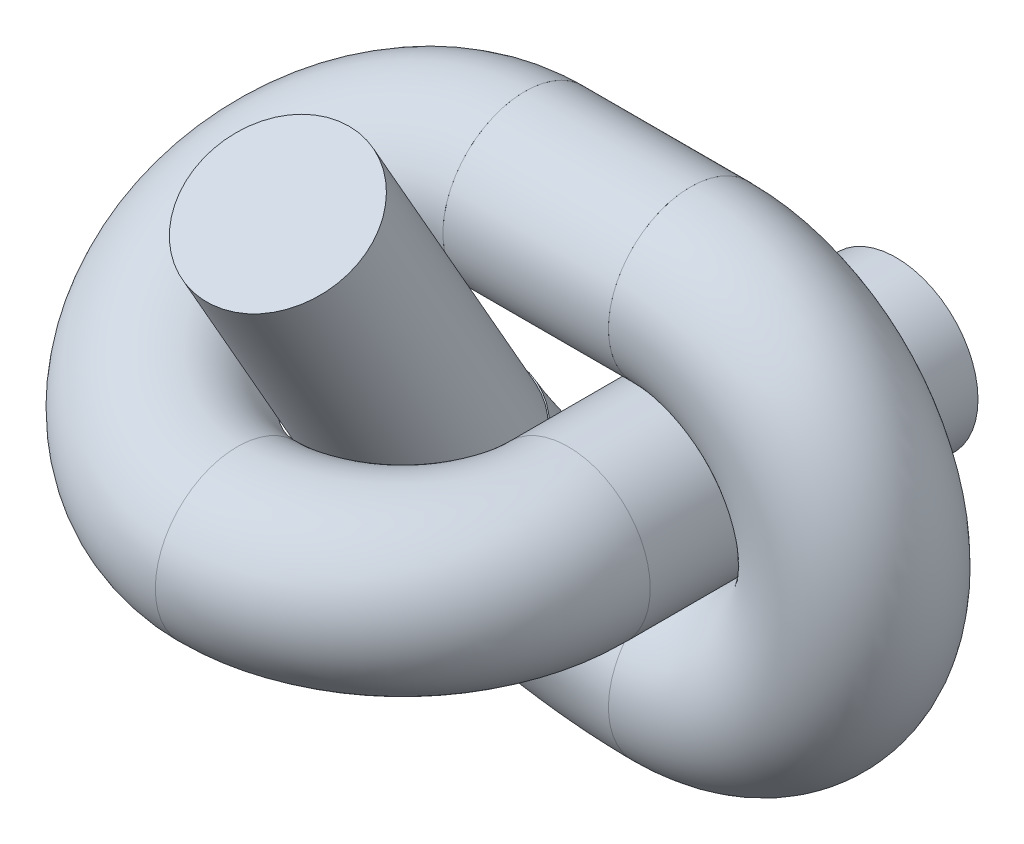
from build123d import *

# Parameters (mm, degrees)
SKETCH1_R                = 2.5
BOSS_EXTRUDE1_DEPTH      = 10
SKETCH3_R                = 2.5
SKETCH4_R                = 2.5
BOSS_EXTRUDE2_DEPTH      = 5.05
SKETCH8_R                = 2.5
SKETCH14_R               = 2.5
BOSS_EXTRUDE3_DEPTH      = 3.64
BOSS_EXTRUDE3_DEPTH_BACK = 6.36
SKETCH58_R               = 2.5
SWEEP39_OUTLINE_R        = 2.5
SWEEP39_ANGLE            = 90


# Read off the part's stored shape, not the designer's step: Sweep39
with BuildPart() as part:
    # Sketch1 → Boss-Extrude1 (new body)
    with BuildSketch(Plane.XY):
        Circle(SKETCH1_R)
    extrude(amount=BOSS_EXTRUDE1_DEPTH)

    # Sweep1: sweep along a path in Sketch2
    with BuildLine(Plane(origin=(0, 0, 0), x_dir=(1, 0, 0), z_dir=(0, 1, 0))) as sweep1_path:
        ThreePointArc((-5.05, -15.05), (-1.479110755, -13.570889245), (0, -10))
    # Sketch3 → Sweep1 (sweep)
    with BuildSketch(Plane.XY.offset(10)):
        Circle(SKETCH3_R)
    sweep(path=sweep1_path.line)

    # Sweep10: sweep along a path in Sketch7
    with BuildLine(Plane(origin=(0, 6.473472664, 3.688363886), x_dir=(-1, 0, 0), z_dir=(0, -0.8688647694827255, -0.49504950495049516))) as sweep10_path:
        ThreePointArc((5.05, -13.076414781), (10.1, -8.026414781), (5.05, -2.976414781))
    # Sketch8 → Sweep10 (sweep)
    with BuildSketch(Plane.ZY.offset(5.05)):
        with Locations((15.05, 0)):
            Circle(SKETCH8_R)
    sweep(path=sweep10_path.line)


with BuildPart() as body_2:
    # Sketch4 → Boss-Extrude2 (new body)
    with BuildSketch(Plane(origin=(0, 0, 0), x_dir=(0, 0, -1), z_dir=(1, 0, 0))):
        with Locations((-6.274465828, 5)):
            Circle(SKETCH4_R)
    extrude(amount=-BOSS_EXTRUDE2_DEPTH)


with BuildPart() as body_3:
    # Sweep38: sweep along a path in Sketch57
    with BuildLine(Plane.XY.offset(6.274465828)) as sweep38_path:
        ThreePointArc((0, 5), (5, 0), (0, -5))
    # Sketch14 → Sweep38 (sweep)
    with BuildSketch(Plane(origin=(0, 0, 0), x_dir=(0, 0, -1), z_dir=(1, 0, 0))):
        with Locations((-6.274465828, 5)):
            Circle(SKETCH14_R)
    sweep(path=sweep38_path.line)

    # Sweep39 outline → Sweep39 (revolve)
    with BuildSketch(Plane(origin=(0, 3.368574828, 1.970736234), x_dir=(0, -0.8631387162148537, -0.5049668866083937), z_dir=(1, 0, 0))):
        with Locations((5.05, -7.940568813)):
            Circle(SWEEP39_OUTLINE_R)
    revolve(axis=Axis((0, 3.368574828, 1.970736234), (0, 0.5049668866083938, -0.8631387162148539)), revolution_arc=SWEEP39_ANGLE)


with BuildPart() as body_4:
    # Sketch58 → Boss-Extrude3 (new, two sides: drawn at the far end of the back side and taken through both)
    with BuildSketch(Plane(origin=(0, 6.473472664, 3.688363886), x_dir=(-1, 0, 0), z_dir=(0, -0.8688647694827255, -0.49504950495049516)).offset(-BOSS_EXTRUDE3_DEPTH_BACK)):
        with Locations(Location((5.05, -8.026414781, 0), (0, 0, 90))):
            Circle(SKETCH58_R)
    extrude(amount=BOSS_EXTRUDE3_DEPTH + BOSS_EXTRUDE3_DEPTH_BACK)


solid = Compound([part.part, body_2.part, body_3.part, body_4.part])
